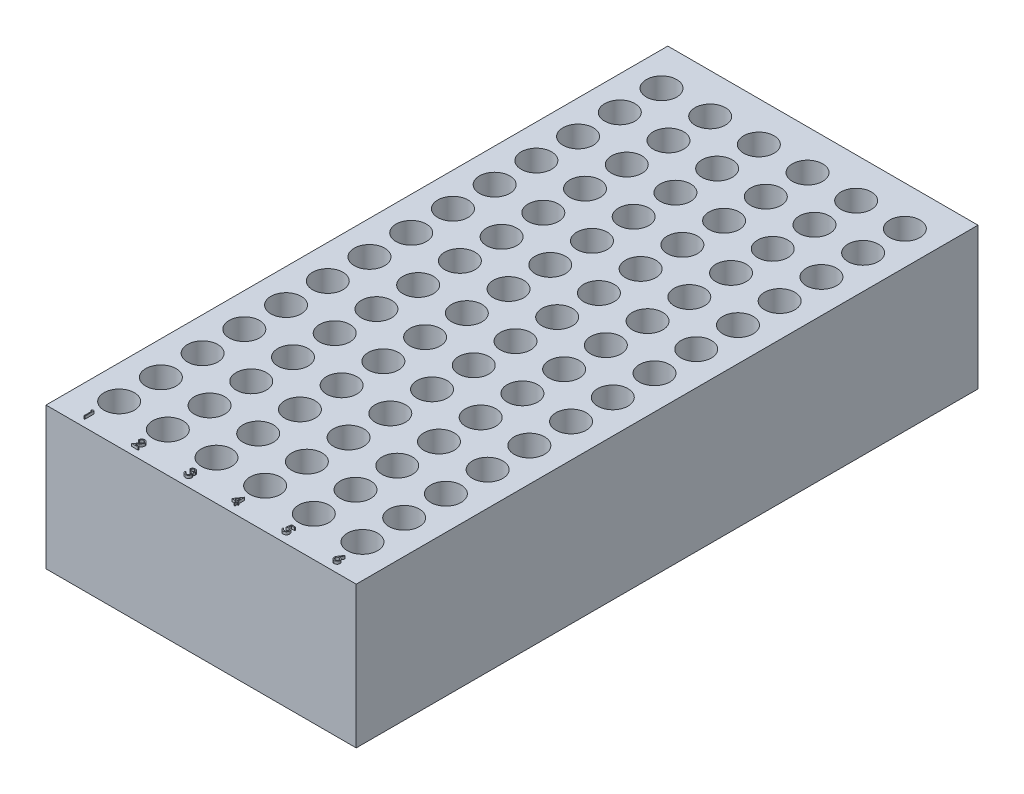
from build123d import *

# Parameters (mm, degrees)
SKETCH1_W                  = 115.25
SKETCH1_H                  = 231
SKETCH1_R                  = 5.65
BOSS_EXTRUDE1_DEPTH        = 21.7
SKETCH2_W                  = 115.25
SKETCH2_H                  = 231
BOSS_EXTRUDE2_DEPTH        = 31
SKETCH6_R                  = 4.225
CUT_EXTRUDE1_DEPTH         = 30
SHELL11_T                  = -0.5
SHELL11_THICKNESS_2_FACE_W = 230
SHELL11_THICKNESS_2_FACE_H = 52.2
SHELL11_THICKNESS_2_DEPTH  = 4.5
SHELL11_THICKNESS_3_FACE_W = 109.75
SHELL11_THICKNESS_3_FACE_H = 52.2
SHELL11_THICKNESS_3_DEPTH  = 4.5
SHELL11_THICKNESS_4_FACE_W = 225.5
SHELL11_THICKNESS_4_FACE_H = 52.2
SHELL11_THICKNESS_4_DEPTH  = 4.5
SHELL11_THICKNESS_5_FACE_W = 105.25
SHELL11_THICKNESS_5_FACE_H = 52.2
SHELL11_THICKNESS_5_DEPTH  = 4.5
SHELL11_THICKNESS_6_FACE_W = 221
SHELL11_THICKNESS_6_FACE_H = 105.25
SHELL11_THICKNESS_6_FACE_R = 6.15
SHELL11_THICKNESS_6_DEPTH  = 4.5
BOSS_EXTRUDE5_DEPTH        = 1


with BuildPart() as part:
    # Sketch1 → Boss-Extrude1 (new body)
    with BuildSketch(Plane(origin=(0, 0, 0), x_dir=(1, 0, 0), z_dir=(0, 1, 0))):
        Rectangle(SKETCH1_W, SKETCH1_H)
        with Locations((-45.196428571, 100.75)):
            Circle(SKETCH1_R, mode=Mode.SUBTRACT)
        with Locations((-27.117857143, 100.75)):
            Circle(SKETCH1_R, mode=Mode.SUBTRACT)
        with Locations((-9.039285714, 100.75)):
            Circle(SKETCH1_R, mode=Mode.SUBTRACT)
        with Locations((9.039285714, 100.75)):
            Circle(SKETCH1_R, mode=Mode.SUBTRACT)
        with Locations((27.117857143, 100.75)):
            Circle(SKETCH1_R, mode=Mode.SUBTRACT)
        with Locations((45.196428571, 100.75)):
            Circle(SKETCH1_R, mode=Mode.SUBTRACT)
        with Locations((-45.196428571, 85.25)):
            Circle(SKETCH1_R, mode=Mode.SUBTRACT)
        with Locations((-27.117857143, 85.25)):
            Circle(SKETCH1_R, mode=Mode.SUBTRACT)
        with Locations((-9.039285714, 85.25)):
            Circle(SKETCH1_R, mode=Mode.SUBTRACT)
        with Locations((9.039285714, 85.25)):
            Circle(SKETCH1_R, mode=Mode.SUBTRACT)
        with Locations((27.117857143, 85.25)):
            Circle(SKETCH1_R, mode=Mode.SUBTRACT)
        with Locations((45.196428571, 85.25)):
            Circle(SKETCH1_R, mode=Mode.SUBTRACT)
        with Locations((-45.196428571, 69.75)):
            Circle(SKETCH1_R, mode=Mode.SUBTRACT)
        with Locations((-27.117857143, 69.75)):
            Circle(SKETCH1_R, mode=Mode.SUBTRACT)
        with Locations((-9.039285714, 69.75)):
            Circle(SKETCH1_R, mode=Mode.SUBTRACT)
        with Locations((9.039285714, 69.75)):
            Circle(SKETCH1_R, mode=Mode.SUBTRACT)
        with Locations((27.117857143, 69.75)):
            Circle(SKETCH1_R, mode=Mode.SUBTRACT)
        with Locations((45.196428571, 69.75)):
            Circle(SKETCH1_R, mode=Mode.SUBTRACT)
        with Locations((-45.196428571, 54.25)):
            Circle(SKETCH1_R, mode=Mode.SUBTRACT)
        with Locations((-27.117857143, 54.25)):
            Circle(SKETCH1_R, mode=Mode.SUBTRACT)
        with Locations((-9.039285714, 54.25)):
            Circle(SKETCH1_R, mode=Mode.SUBTRACT)
        with Locations((9.039285714, 54.25)):
            Circle(SKETCH1_R, mode=Mode.SUBTRACT)
        with Locations((27.117857143, 54.25)):
            Circle(SKETCH1_R, mode=Mode.SUBTRACT)
        with Locations((45.196428571, 54.25)):
            Circle(SKETCH1_R, mode=Mode.SUBTRACT)
        with Locations((-45.196428571, 38.75)):
            Circle(SKETCH1_R, mode=Mode.SUBTRACT)
        with Locations((-27.117857143, 38.75)):
            Circle(SKETCH1_R, mode=Mode.SUBTRACT)
        with Locations((-9.039285714, 38.75)):
            Circle(SKETCH1_R, mode=Mode.SUBTRACT)
        with Locations((9.039285714, 38.75)):
            Circle(SKETCH1_R, mode=Mode.SUBTRACT)
        with Locations((27.117857143, 38.75)):
            Circle(SKETCH1_R, mode=Mode.SUBTRACT)
        with Locations((45.196428571, 38.75)):
            Circle(SKETCH1_R, mode=Mode.SUBTRACT)
        with Locations((-45.196428571, 23.25)):
            Circle(SKETCH1_R, mode=Mode.SUBTRACT)
        with Locations((-27.117857143, 23.25)):
            Circle(SKETCH1_R, mode=Mode.SUBTRACT)
        with Locations((-9.039285714, 23.25)):
            Circle(SKETCH1_R, mode=Mode.SUBTRACT)
        with Locations((9.039285714, 23.25)):
            Circle(SKETCH1_R, mode=Mode.SUBTRACT)
        with Locations((27.117857143, 23.25)):
            Circle(SKETCH1_R, mode=Mode.SUBTRACT)
        with Locations((45.196428571, 23.25)):
            Circle(SKETCH1_R, mode=Mode.SUBTRACT)
        with Locations((-45.196428571, 7.75)):
            Circle(SKETCH1_R, mode=Mode.SUBTRACT)
        with Locations((-27.117857143, 7.75)):
            Circle(SKETCH1_R, mode=Mode.SUBTRACT)
        with Locations((-9.039285714, 7.75)):
            Circle(SKETCH1_R, mode=Mode.SUBTRACT)
        with Locations((9.039285714, 7.75)):
            Circle(SKETCH1_R, mode=Mode.SUBTRACT)
        with Locations((27.117857143, 7.75)):
            Circle(SKETCH1_R, mode=Mode.SUBTRACT)
        with Locations((45.196428571, 7.75)):
            Circle(SKETCH1_R, mode=Mode.SUBTRACT)
        with Locations((-45.196428571, -7.75)):
            Circle(SKETCH1_R, mode=Mode.SUBTRACT)
        with Locations((-27.117857143, -7.75)):
            Circle(SKETCH1_R, mode=Mode.SUBTRACT)
        with Locations((-9.039285714, -7.75)):
            Circle(SKETCH1_R, mode=Mode.SUBTRACT)
        with Locations((9.039285714, -7.75)):
            Circle(SKETCH1_R, mode=Mode.SUBTRACT)
        with Locations((27.117857143, -7.75)):
            Circle(SKETCH1_R, mode=Mode.SUBTRACT)
        with Locations((45.196428571, -7.75)):
            Circle(SKETCH1_R, mode=Mode.SUBTRACT)
        with Locations((-45.196428571, -23.25)):
            Circle(SKETCH1_R, mode=Mode.SUBTRACT)
        with Locations((-27.117857143, -23.25)):
            Circle(SKETCH1_R, mode=Mode.SUBTRACT)
        with Locations((-9.039285714, -23.25)):
            Circle(SKETCH1_R, mode=Mode.SUBTRACT)
        with Locations((9.039285714, -23.25)):
            Circle(SKETCH1_R, mode=Mode.SUBTRACT)
        with Locations((27.117857143, -23.25)):
            Circle(SKETCH1_R, mode=Mode.SUBTRACT)
        with Locations((45.196428571, -23.25)):
            Circle(SKETCH1_R, mode=Mode.SUBTRACT)
        with Locations((-45.196428571, -38.75)):
            Circle(SKETCH1_R, mode=Mode.SUBTRACT)
        with Locations((-27.117857143, -38.75)):
            Circle(SKETCH1_R, mode=Mode.SUBTRACT)
        with Locations((-9.039285714, -38.75)):
            Circle(SKETCH1_R, mode=Mode.SUBTRACT)
        with Locations((9.039285714, -38.75)):
            Circle(SKETCH1_R, mode=Mode.SUBTRACT)
        with Locations((27.117857143, -38.75)):
            Circle(SKETCH1_R, mode=Mode.SUBTRACT)
        with Locations((45.196428571, -38.75)):
            Circle(SKETCH1_R, mode=Mode.SUBTRACT)
        with Locations((-45.196428571, -54.25)):
            Circle(SKETCH1_R, mode=Mode.SUBTRACT)
        with Locations((-27.117857143, -54.25)):
            Circle(SKETCH1_R, mode=Mode.SUBTRACT)
        with Locations((-9.039285714, -54.25)):
            Circle(SKETCH1_R, mode=Mode.SUBTRACT)
        with Locations((9.039285714, -54.25)):
            Circle(SKETCH1_R, mode=Mode.SUBTRACT)
        with Locations((27.117857143, -54.25)):
            Circle(SKETCH1_R, mode=Mode.SUBTRACT)
        with Locations((45.196428571, -54.25)):
            Circle(SKETCH1_R, mode=Mode.SUBTRACT)
        with Locations((-45.196428571, -69.75)):
            Circle(SKETCH1_R, mode=Mode.SUBTRACT)
        with Locations((-27.117857143, -69.75)):
            Circle(SKETCH1_R, mode=Mode.SUBTRACT)
        with Locations((-9.039285714, -69.75)):
            Circle(SKETCH1_R, mode=Mode.SUBTRACT)
        with Locations((9.039285714, -69.75)):
            Circle(SKETCH1_R, mode=Mode.SUBTRACT)
        with Locations((27.117857143, -69.75)):
            Circle(SKETCH1_R, mode=Mode.SUBTRACT)
        with Locations((45.196428571, -69.75)):
            Circle(SKETCH1_R, mode=Mode.SUBTRACT)
        with Locations((-45.196428571, -85.25)):
            Circle(SKETCH1_R, mode=Mode.SUBTRACT)
        with Locations((-27.117857143, -85.25)):
            Circle(SKETCH1_R, mode=Mode.SUBTRACT)
        with Locations((-9.039285714, -85.25)):
            Circle(SKETCH1_R, mode=Mode.SUBTRACT)
        with Locations((9.039285714, -85.25)):
            Circle(SKETCH1_R, mode=Mode.SUBTRACT)
        with Locations((27.117857143, -85.25)):
            Circle(SKETCH1_R, mode=Mode.SUBTRACT)
        with Locations((45.196428571, -85.25)):
            Circle(SKETCH1_R, mode=Mode.SUBTRACT)
        with Locations((-45.196428571, -100.75)):
            Circle(SKETCH1_R, mode=Mode.SUBTRACT)
        with Locations((-27.117857143, -100.75)):
            Circle(SKETCH1_R, mode=Mode.SUBTRACT)
        with Locations((-9.039285714, -100.75)):
            Circle(SKETCH1_R, mode=Mode.SUBTRACT)
        with Locations((9.039285714, -100.75)):
            Circle(SKETCH1_R, mode=Mode.SUBTRACT)
        with Locations((27.117857143, -100.75)):
            Circle(SKETCH1_R, mode=Mode.SUBTRACT)
        with Locations((45.196428571, -100.75)):
            Circle(SKETCH1_R, mode=Mode.SUBTRACT)
    extrude(amount=BOSS_EXTRUDE1_DEPTH)

    # Sketch2 → Boss-Extrude2 (add)
    with BuildSketch(Plane.XZ):
        Rectangle(SKETCH2_W, SKETCH2_H)
    extrude(amount=BOSS_EXTRUDE2_DEPTH)

    # Sketch6 → Cut-Extrude1 (cut)
    with BuildSketch(Plane(origin=(0, 0, 0), x_dir=(1, 0, 0), z_dir=(0, 1, 0))):
        with Locations((-45.196428571, 100.75)):
            Circle(SKETCH6_R)
        with Locations((-27.116428571, 100.75)):
            Circle(SKETCH6_R)
        with Locations((-9.036428571, 100.75)):
            Circle(SKETCH6_R)
        with Locations((9.043571429, 100.75)):
            Circle(SKETCH6_R)
        with Locations((27.123571429, 100.75)):
            Circle(SKETCH6_R)
        with Locations((45.203571429, 100.75)):
            Circle(SKETCH6_R)
        with Locations((-45.196428571, 85.25)):
            Circle(SKETCH6_R)
        with Locations((-27.116428571, 85.25)):
            Circle(SKETCH6_R)
        with Locations((-9.036428571, 85.25)):
            Circle(SKETCH6_R)
        with Locations((9.043571429, 85.25)):
            Circle(SKETCH6_R)
        with Locations((27.123571429, 85.25)):
            Circle(SKETCH6_R)
        with Locations((45.203571429, 85.25)):
            Circle(SKETCH6_R)
        with Locations((-45.196428571, 69.75)):
            Circle(SKETCH6_R)
        with Locations((-27.116428571, 69.75)):
            Circle(SKETCH6_R)
        with Locations((-9.036428571, 69.75)):
            Circle(SKETCH6_R)
        with Locations((9.043571429, 69.75)):
            Circle(SKETCH6_R)
        with Locations((27.123571429, 69.75)):
            Circle(SKETCH6_R)
        with Locations((45.203571429, 69.75)):
            Circle(SKETCH6_R)
        with Locations((-45.196428571, 54.25)):
            Circle(SKETCH6_R)
        with Locations((-27.116428571, 54.25)):
            Circle(SKETCH6_R)
        with Locations((-9.036428571, 54.25)):
            Circle(SKETCH6_R)
        with Locations((9.043571429, 54.25)):
            Circle(SKETCH6_R)
        with Locations((27.123571429, 54.25)):
            Circle(SKETCH6_R)
        with Locations((45.203571429, 54.25)):
            Circle(SKETCH6_R)
        with Locations((-45.196428571, 38.75)):
            Circle(SKETCH6_R)
        with Locations((-27.116428571, 38.75)):
            Circle(SKETCH6_R)
        with Locations((-9.036428571, 38.75)):
            Circle(SKETCH6_R)
        with Locations((9.043571429, 38.75)):
            Circle(SKETCH6_R)
        with Locations((27.123571429, 38.75)):
            Circle(SKETCH6_R)
        with Locations((45.203571429, 38.75)):
            Circle(SKETCH6_R)
        with Locations((-45.196428571, 23.25)):
            Circle(SKETCH6_R)
        with Locations((-27.116428571, 23.25)):
            Circle(SKETCH6_R)
        with Locations((-9.036428571, 23.25)):
            Circle(SKETCH6_R)
        with Locations((9.043571429, 23.25)):
            Circle(SKETCH6_R)
        with Locations((27.123571429, 23.25)):
            Circle(SKETCH6_R)
        with Locations((45.203571429, 23.25)):
            Circle(SKETCH6_R)
        with Locations((-45.196428571, 7.75)):
            Circle(SKETCH6_R)
        with Locations((-27.116428571, 7.75)):
            Circle(SKETCH6_R)
        with Locations((-9.036428571, 7.75)):
            Circle(SKETCH6_R)
        with Locations((9.043571429, 7.75)):
            Circle(SKETCH6_R)
        with Locations((27.123571429, 7.75)):
            Circle(SKETCH6_R)
        with Locations((45.203571429, 7.75)):
            Circle(SKETCH6_R)
        with Locations((-45.196428571, -7.75)):
            Circle(SKETCH6_R)
        with Locations((-27.116428571, -7.75)):
            Circle(SKETCH6_R)
        with Locations((-9.036428571, -7.75)):
            Circle(SKETCH6_R)
        with Locations((9.043571429, -7.75)):
            Circle(SKETCH6_R)
        with Locations((27.123571429, -7.75)):
            Circle(SKETCH6_R)
        with Locations((45.203571429, -7.75)):
            Circle(SKETCH6_R)
        with Locations((-45.196428571, -23.25)):
            Circle(SKETCH6_R)
        with Locations((-27.116428571, -23.25)):
            Circle(SKETCH6_R)
        with Locations((-9.036428571, -23.25)):
            Circle(SKETCH6_R)
        with Locations((9.043571429, -23.25)):
            Circle(SKETCH6_R)
        with Locations((27.123571429, -23.25)):
            Circle(SKETCH6_R)
        with Locations((45.203571429, -23.25)):
            Circle(SKETCH6_R)
        with Locations((-45.196428571, -38.75)):
            Circle(SKETCH6_R)
        with Locations((-27.116428571, -38.75)):
            Circle(SKETCH6_R)
        with Locations((-9.036428571, -38.75)):
            Circle(SKETCH6_R)
        with Locations((9.043571429, -38.75)):
            Circle(SKETCH6_R)
        with Locations((27.123571429, -38.75)):
            Circle(SKETCH6_R)
        with Locations((45.203571429, -38.75)):
            Circle(SKETCH6_R)
        with Locations((-45.196428571, -54.25)):
            Circle(SKETCH6_R)
        with Locations((-27.116428571, -54.25)):
            Circle(SKETCH6_R)
        with Locations((-9.036428571, -54.25)):
            Circle(SKETCH6_R)
        with Locations((9.043571429, -54.25)):
            Circle(SKETCH6_R)
        with Locations((27.123571429, -54.25)):
            Circle(SKETCH6_R)
        with Locations((45.203571429, -54.25)):
            Circle(SKETCH6_R)
        with Locations((-45.196428571, -69.75)):
            Circle(SKETCH6_R)
        with Locations((-27.116428571, -69.75)):
            Circle(SKETCH6_R)
        with Locations((-9.036428571, -69.75)):
            Circle(SKETCH6_R)
        with Locations((9.043571429, -69.75)):
            Circle(SKETCH6_R)
        with Locations((27.123571429, -69.75)):
            Circle(SKETCH6_R)
        with Locations((45.203571429, -69.75)):
            Circle(SKETCH6_R)
        with Locations((-45.196428571, -85.25)):
            Circle(SKETCH6_R)
        with Locations((-27.116428571, -85.25)):
            Circle(SKETCH6_R)
        with Locations((-9.036428571, -85.25)):
            Circle(SKETCH6_R)
        with Locations((9.043571429, -85.25)):
            Circle(SKETCH6_R)
        with Locations((27.123571429, -85.25)):
            Circle(SKETCH6_R)
        with Locations((45.203571429, -85.25)):
            Circle(SKETCH6_R)
        with Locations((-45.196428571, -100.75)):
            Circle(SKETCH6_R)
        with Locations((-27.116428571, -100.75)):
            Circle(SKETCH6_R)
        with Locations((-9.036428571, -100.75)):
            Circle(SKETCH6_R)
        with Locations((9.043571429, -100.75)):
            Circle(SKETCH6_R)
        with Locations((27.123571429, -100.75)):
            Circle(SKETCH6_R)
        with Locations((45.203571429, -100.75)):
            Circle(SKETCH6_R)
    extrude(amount=-CUT_EXTRUDE1_DEPTH, mode=Mode.SUBTRACT)

    # Shell11
    shell11_openings = [part.faces().sort_by_distance(p)[0] for p in [
        (0, -31, 0),
    ]]
    offset(amount=SHELL11_T, openings=shell11_openings, kind=Kind.INTERSECTION)

    # Shell11 thickness 2 face (on inner face of the shell) → Shell11 thickness 2 (add)
    with BuildSketch(Plane(origin=(57.125, -4.9, 0), x_dir=(0, 0, 1), z_dir=(1, 0, 0))):
        Rectangle(SHELL11_THICKNESS_2_FACE_W, SHELL11_THICKNESS_2_FACE_H)
    extrude(amount=-SHELL11_THICKNESS_2_DEPTH)

    # Shell11 thickness 3 face (on inner face of the shell) → Shell11 thickness 3 (add)
    with BuildSketch(Plane(origin=(-2.25, -4.9, 115), x_dir=(1, 0, 0), z_dir=(0, 0, 1))):
        Rectangle(SHELL11_THICKNESS_3_FACE_W, SHELL11_THICKNESS_3_FACE_H)
    extrude(amount=-SHELL11_THICKNESS_3_DEPTH)

    # Shell11 thickness 4 face (on inner face of the shell) → Shell11 thickness 4 (add)
    with BuildSketch(Plane(origin=(-57.125, -4.9, -2.25), x_dir=(0, 0, -1), z_dir=(-1, 0, 0))):
        Rectangle(SHELL11_THICKNESS_4_FACE_W, SHELL11_THICKNESS_4_FACE_H)
    extrude(amount=-SHELL11_THICKNESS_4_DEPTH)

    # Shell11 thickness 5 face (on inner face of the shell) → Shell11 thickness 5 (add)
    with BuildSketch(Plane(origin=(0, -4.9, -115), x_dir=(-1, 0, 0), z_dir=(0, 0, -1))):
        Rectangle(SHELL11_THICKNESS_5_FACE_W, SHELL11_THICKNESS_5_FACE_H)
    extrude(amount=-SHELL11_THICKNESS_5_DEPTH)

    # Shell11 thickness 6 face (on inner face of the shell) → Shell11 thickness 6 (add)
    with BuildSketch(Plane.ZX.offset(21.2)):
        Rectangle(SHELL11_THICKNESS_6_FACE_W, SHELL11_THICKNESS_6_FACE_H)
        with Locations((100.75, 45.196428571)):
            Circle(SHELL11_THICKNESS_6_FACE_R, mode=Mode.SUBTRACT)
        with Locations((85.25, 45.196428571)):
            Circle(SHELL11_THICKNESS_6_FACE_R, mode=Mode.SUBTRACT)
        with Locations((100.75, 27.117857143)):
            Circle(SHELL11_THICKNESS_6_FACE_R, mode=Mode.SUBTRACT)
        with Locations((85.25, 27.117857143)):
            Circle(SHELL11_THICKNESS_6_FACE_R, mode=Mode.SUBTRACT)
        with Locations((69.75, 45.196428571)):
            Circle(SHELL11_THICKNESS_6_FACE_R, mode=Mode.SUBTRACT)
        with Locations((54.25, 45.196428571)):
            Circle(SHELL11_THICKNESS_6_FACE_R, mode=Mode.SUBTRACT)
        with Locations((69.75, 27.117857143)):
            Circle(SHELL11_THICKNESS_6_FACE_R, mode=Mode.SUBTRACT)
        with Locations((54.25, 27.117857143)):
            Circle(SHELL11_THICKNESS_6_FACE_R, mode=Mode.SUBTRACT)
        with Locations((100.75, 9.039285714)):
            Circle(SHELL11_THICKNESS_6_FACE_R, mode=Mode.SUBTRACT)
        with Locations((85.25, 9.039285714)):
            Circle(SHELL11_THICKNESS_6_FACE_R, mode=Mode.SUBTRACT)
        with Locations((69.75, 9.039285714)):
            Circle(SHELL11_THICKNESS_6_FACE_R, mode=Mode.SUBTRACT)
        with Locations((54.25, 9.039285714)):
            Circle(SHELL11_THICKNESS_6_FACE_R, mode=Mode.SUBTRACT)
        with Locations((38.75, 45.196428571)):
            Circle(SHELL11_THICKNESS_6_FACE_R, mode=Mode.SUBTRACT)
        with Locations((38.75, 27.117857143)):
            Circle(SHELL11_THICKNESS_6_FACE_R, mode=Mode.SUBTRACT)
        with Locations((23.25, 45.196428571)):
            Circle(SHELL11_THICKNESS_6_FACE_R, mode=Mode.SUBTRACT)
        with Locations((7.75, 45.196428571)):
            Circle(SHELL11_THICKNESS_6_FACE_R, mode=Mode.SUBTRACT)
        with Locations((23.25, 27.117857143)):
            Circle(SHELL11_THICKNESS_6_FACE_R, mode=Mode.SUBTRACT)
        with Locations((7.75, 27.117857143)):
            Circle(SHELL11_THICKNESS_6_FACE_R, mode=Mode.SUBTRACT)
        with Locations((38.75, 9.039285714)):
            Circle(SHELL11_THICKNESS_6_FACE_R, mode=Mode.SUBTRACT)
        with Locations((23.25, 9.039285714)):
            Circle(SHELL11_THICKNESS_6_FACE_R, mode=Mode.SUBTRACT)
        with Locations((7.75, 9.039285714)):
            Circle(SHELL11_THICKNESS_6_FACE_R, mode=Mode.SUBTRACT)
        with Locations((100.75, -9.039285714)):
            Circle(SHELL11_THICKNESS_6_FACE_R, mode=Mode.SUBTRACT)
        with Locations((85.25, -9.039285714)):
            Circle(SHELL11_THICKNESS_6_FACE_R, mode=Mode.SUBTRACT)
        with Locations((69.75, -9.039285714)):
            Circle(SHELL11_THICKNESS_6_FACE_R, mode=Mode.SUBTRACT)
        with Locations((54.25, -9.039285714)):
            Circle(SHELL11_THICKNESS_6_FACE_R, mode=Mode.SUBTRACT)
        with Locations((100.75, -27.117857143)):
            Circle(SHELL11_THICKNESS_6_FACE_R, mode=Mode.SUBTRACT)
        with Locations((85.25, -27.117857143)):
            Circle(SHELL11_THICKNESS_6_FACE_R, mode=Mode.SUBTRACT)
        with Locations((100.75, -45.196428571)):
            Circle(SHELL11_THICKNESS_6_FACE_R, mode=Mode.SUBTRACT)
        with Locations((85.25, -45.196428571)):
            Circle(SHELL11_THICKNESS_6_FACE_R, mode=Mode.SUBTRACT)
        with Locations((69.75, -27.117857143)):
            Circle(SHELL11_THICKNESS_6_FACE_R, mode=Mode.SUBTRACT)
        with Locations((54.25, -27.117857143)):
            Circle(SHELL11_THICKNESS_6_FACE_R, mode=Mode.SUBTRACT)
        with Locations((69.75, -45.196428571)):
            Circle(SHELL11_THICKNESS_6_FACE_R, mode=Mode.SUBTRACT)
        with Locations((54.25, -45.196428571)):
            Circle(SHELL11_THICKNESS_6_FACE_R, mode=Mode.SUBTRACT)
        with Locations((38.75, -9.039285714)):
            Circle(SHELL11_THICKNESS_6_FACE_R, mode=Mode.SUBTRACT)
        with Locations((23.25, -9.039285714)):
            Circle(SHELL11_THICKNESS_6_FACE_R, mode=Mode.SUBTRACT)
        with Locations((7.75, -9.039285714)):
            Circle(SHELL11_THICKNESS_6_FACE_R, mode=Mode.SUBTRACT)
        with Locations((38.75, -27.117857143)):
            Circle(SHELL11_THICKNESS_6_FACE_R, mode=Mode.SUBTRACT)
        with Locations((38.75, -45.196428571)):
            Circle(SHELL11_THICKNESS_6_FACE_R, mode=Mode.SUBTRACT)
        with Locations((23.25, -27.117857143)):
            Circle(SHELL11_THICKNESS_6_FACE_R, mode=Mode.SUBTRACT)
        with Locations((7.75, -27.117857143)):
            Circle(SHELL11_THICKNESS_6_FACE_R, mode=Mode.SUBTRACT)
        with Locations((23.25, -45.196428571)):
            Circle(SHELL11_THICKNESS_6_FACE_R, mode=Mode.SUBTRACT)
        with Locations((7.75, -45.196428571)):
            Circle(SHELL11_THICKNESS_6_FACE_R, mode=Mode.SUBTRACT)
        with Locations((-7.75, 45.196428571)):
            Circle(SHELL11_THICKNESS_6_FACE_R, mode=Mode.SUBTRACT)
        with Locations((-23.25, 45.196428571)):
            Circle(SHELL11_THICKNESS_6_FACE_R, mode=Mode.SUBTRACT)
        with Locations((-7.75, 27.117857143)):
            Circle(SHELL11_THICKNESS_6_FACE_R, mode=Mode.SUBTRACT)
        with Locations((-23.25, 27.117857143)):
            Circle(SHELL11_THICKNESS_6_FACE_R, mode=Mode.SUBTRACT)
        with Locations((-38.75, 45.196428571)):
            Circle(SHELL11_THICKNESS_6_FACE_R, mode=Mode.SUBTRACT)
        with Locations((-38.75, 27.117857143)):
            Circle(SHELL11_THICKNESS_6_FACE_R, mode=Mode.SUBTRACT)
        with Locations((-7.75, 9.039285714)):
            Circle(SHELL11_THICKNESS_6_FACE_R, mode=Mode.SUBTRACT)
        with Locations((-23.25, 9.039285714)):
            Circle(SHELL11_THICKNESS_6_FACE_R, mode=Mode.SUBTRACT)
        with Locations((-38.75, 9.039285714)):
            Circle(SHELL11_THICKNESS_6_FACE_R, mode=Mode.SUBTRACT)
        with Locations((-54.25, 45.196428571)):
            Circle(SHELL11_THICKNESS_6_FACE_R, mode=Mode.SUBTRACT)
        with Locations((-69.75, 45.196428571)):
            Circle(SHELL11_THICKNESS_6_FACE_R, mode=Mode.SUBTRACT)
        with Locations((-54.25, 27.117857143)):
            Circle(SHELL11_THICKNESS_6_FACE_R, mode=Mode.SUBTRACT)
        with Locations((-69.75, 27.117857143)):
            Circle(SHELL11_THICKNESS_6_FACE_R, mode=Mode.SUBTRACT)
        with Locations((-85.25, 45.196428571)):
            Circle(SHELL11_THICKNESS_6_FACE_R, mode=Mode.SUBTRACT)
        with Locations((-100.75, 45.196428571)):
            Circle(SHELL11_THICKNESS_6_FACE_R, mode=Mode.SUBTRACT)
        with Locations((-85.25, 27.117857143)):
            Circle(SHELL11_THICKNESS_6_FACE_R, mode=Mode.SUBTRACT)
        with Locations((-100.75, 27.117857143)):
            Circle(SHELL11_THICKNESS_6_FACE_R, mode=Mode.SUBTRACT)
        with Locations((-54.25, 9.039285714)):
            Circle(SHELL11_THICKNESS_6_FACE_R, mode=Mode.SUBTRACT)
        with Locations((-69.75, 9.039285714)):
            Circle(SHELL11_THICKNESS_6_FACE_R, mode=Mode.SUBTRACT)
        with Locations((-85.25, 9.039285714)):
            Circle(SHELL11_THICKNESS_6_FACE_R, mode=Mode.SUBTRACT)
        with Locations((-100.75, 9.039285714)):
            Circle(SHELL11_THICKNESS_6_FACE_R, mode=Mode.SUBTRACT)
        with Locations((-7.75, -9.039285714)):
            Circle(SHELL11_THICKNESS_6_FACE_R, mode=Mode.SUBTRACT)
        with Locations((-23.25, -9.039285714)):
            Circle(SHELL11_THICKNESS_6_FACE_R, mode=Mode.SUBTRACT)
        with Locations((-38.75, -9.039285714)):
            Circle(SHELL11_THICKNESS_6_FACE_R, mode=Mode.SUBTRACT)
        with Locations((-7.75, -27.117857143)):
            Circle(SHELL11_THICKNESS_6_FACE_R, mode=Mode.SUBTRACT)
        with Locations((-23.25, -27.117857143)):
            Circle(SHELL11_THICKNESS_6_FACE_R, mode=Mode.SUBTRACT)
        with Locations((-7.75, -45.196428571)):
            Circle(SHELL11_THICKNESS_6_FACE_R, mode=Mode.SUBTRACT)
        with Locations((-23.25, -45.196428571)):
            Circle(SHELL11_THICKNESS_6_FACE_R, mode=Mode.SUBTRACT)
        with Locations((-38.75, -27.117857143)):
            Circle(SHELL11_THICKNESS_6_FACE_R, mode=Mode.SUBTRACT)
        with Locations((-38.75, -45.196428571)):
            Circle(SHELL11_THICKNESS_6_FACE_R, mode=Mode.SUBTRACT)
        with Locations((-54.25, -9.039285714)):
            Circle(SHELL11_THICKNESS_6_FACE_R, mode=Mode.SUBTRACT)
        with Locations((-69.75, -9.039285714)):
            Circle(SHELL11_THICKNESS_6_FACE_R, mode=Mode.SUBTRACT)
        with Locations((-85.25, -9.039285714)):
            Circle(SHELL11_THICKNESS_6_FACE_R, mode=Mode.SUBTRACT)
        with Locations((-100.75, -9.039285714)):
            Circle(SHELL11_THICKNESS_6_FACE_R, mode=Mode.SUBTRACT)
        with Locations((-54.25, -27.117857143)):
            Circle(SHELL11_THICKNESS_6_FACE_R, mode=Mode.SUBTRACT)
        with Locations((-69.75, -27.117857143)):
            Circle(SHELL11_THICKNESS_6_FACE_R, mode=Mode.SUBTRACT)
        with Locations((-54.25, -45.196428571)):
            Circle(SHELL11_THICKNESS_6_FACE_R, mode=Mode.SUBTRACT)
        with Locations((-69.75, -45.196428571)):
            Circle(SHELL11_THICKNESS_6_FACE_R, mode=Mode.SUBTRACT)
        with Locations((-85.25, -27.117857143)):
            Circle(SHELL11_THICKNESS_6_FACE_R, mode=Mode.SUBTRACT)
        with Locations((-100.75, -27.117857143)):
            Circle(SHELL11_THICKNESS_6_FACE_R, mode=Mode.SUBTRACT)
        with Locations((-85.25, -45.196428571)):
            Circle(SHELL11_THICKNESS_6_FACE_R, mode=Mode.SUBTRACT)
        with Locations((-100.75, -45.196428571)):
            Circle(SHELL11_THICKNESS_6_FACE_R, mode=Mode.SUBTRACT)
    extrude(amount=-SHELL11_THICKNESS_6_DEPTH)

    # Sketch5 → Boss-Extrude5 (add)
    # profile 1 of 6: a face of its own
    with BuildSketch(Plane(origin=(0, 21.7, 0), x_dir=(1, 0, 0), z_dir=(0, 1, 0))):
        Polygon((-46.47985045, -109.391028324), (-45.832715033, -109.391028324), (-45.832715033, -112.891028324), (-46.146817598, -112.891028324), (-46.146817598, -109.750002683), (-46.685279136, -109.750002683), align=None)
    # profile 2 of 6: a face of its own
    with BuildSketch(Plane(origin=(0, 21.7, 0), x_dir=(1, 0, 0), z_dir=(0, 1, 0))):
        with BuildLine():
            Line((-27.92886888, -110.467951401), (-28.242971444, -110.467951401))
            add(Edge.make_bspline(
                [(-28.242971444, -110.467951401), (-28.240924291, -110.426280513), (-28.236903737, -110.344439999), (-28.218075447, -110.225116092), (-28.19113457, -110.111061293), (-28.153043116, -110.003191379), (-28.105736838, -109.900552572), (-28.049006811, -109.803552557), (-27.981812961, -109.712561368), (-27.905606226, -109.628422525), (-27.822837587, -109.551234954), (-27.733531648, -109.484579711), (-27.639686621, -109.42826204), (-27.541587222, -109.381180798), (-27.438126658, -109.345840952), (-27.3302438, -109.319619312), (-27.217464664, -109.303842966), (-27.140624642, -109.302147181), (-27.101545162, -109.301284734)],
                knots=[0, 0, 0, 0, 1.10065271, 2.161652631, 3.183658789, 4.190468796, 5.17591951, 6.163126047, 7.15150782, 8.156236427, 9.156009102, 10.134482811, 11.092018607, 12.041330605, 13.001268258, 13.972401359, 14.968799086, 16, 16, 16, 16], degree=3))
            add(Edge.make_bspline(
                [(-27.101545162, -109.301284734), (-27.063167088, -109.302183191), (-26.987755543, -109.303948626), (-26.877693528, -109.319109655), (-26.772916234, -109.342855246), (-26.673628467, -109.376170663), (-26.580622403, -109.42095509), (-26.493199358, -109.474752629), (-26.410318548, -109.53697246), (-26.335711764, -109.610226274), (-26.267203685, -109.688428658), (-26.20810143, -109.771916562), (-26.157488266, -109.858145847), (-26.115300586, -109.947774049), (-26.084244447, -110.041645077), (-26.060666239, -110.13839228), (-26.047338826, -110.239017091), (-26.045293402, -110.307123647), (-26.044253495, -110.341749478)],
                knots=[0, 0, 0, 0, 1.111607364, 2.184268762, 3.212621178, 4.221274766, 5.211760367, 6.196651075, 7.1921475, 8.207485113, 9.220403448, 10.201281604, 11.166441695, 12.114753415, 13.065576456, 14.026450734, 14.996634279, 16, 16, 16, 16], degree=3))
            add(Edge.make_bspline(
                [(-26.044253495, -110.341749478), (-26.045946758, -110.390497312), (-26.049303569, -110.487137526), (-26.078017946, -110.629152389), (-26.122864457, -110.766745808), (-26.176861814, -110.87748311), (-26.231334258, -110.966716604), (-26.280421765, -111.040185309), (-26.337886576, -111.119290777), (-26.404565074, -111.203768114), (-26.479077946, -111.29427902), (-26.56210011, -111.390768815), (-26.654223592, -111.492240585), (-26.718882093, -111.561546186), (-26.752386508, -111.597458612)],
                knots=[0, 0, 0, 0, 1.184426356, 2.348067706, 3.509069118, 4.696110526, 5.333549288, 6.050745305, 6.844228056, 7.710549037, 8.667450064, 9.695053472, 10.805634456, 12, 12, 12, 12], degree=3))
            Line((-26.752386508, -111.597458612), (-27.62808763, -112.532053965))
            Line((-27.62808763, -112.532053965), (-25.9993817, -112.532053965))
            Line((-25.9993817, -112.532053965), (-25.9993817, -112.891028324))
            Line((-25.9993817, -112.891028324), (-28.377586828, -112.891028324))
            Line((-28.377586828, -112.891028324), (-27.020215033, -111.442510696))
            add(Edge.make_bspline(
                [(-27.020215033, -111.442510696), (-26.987167147, -111.408012389), (-26.92368892, -111.341748203), (-26.833906343, -111.245005242), (-26.753267354, -111.155255702), (-26.681249962, -111.072669153), (-26.619416456, -110.996037586), (-26.564544224, -110.927842882), (-26.520578633, -110.865088432), (-26.472863238, -110.792347818), (-26.426649256, -110.703535501), (-26.3869369, -110.595001811), (-26.362722052, -110.483274559), (-26.359817216, -110.407772522), (-26.358356059, -110.36979435)],
                knots=[0, 0, 0, 0, 1.329631726, 2.553950428, 3.673215718, 4.687767853, 5.603093632, 6.413772471, 7.123043292, 7.734684054, 8.834405432, 9.900288307, 10.943827018, 12, 12, 12, 12], degree=3))
            add(Edge.make_bspline(
                [(-26.358356059, -110.36979435), (-26.358991801, -110.345912951), (-26.360244727, -110.298847301), (-26.371302425, -110.229841542), (-26.388012931, -110.163276728), (-26.411958189, -110.098948109), (-26.443564929, -110.037502457), (-26.482038309, -109.978864977), (-26.526428372, -109.922176011), (-26.577779642, -109.869022713), (-26.634191162, -109.820341508), (-26.693785411, -109.777217422), (-26.756835515, -109.741178312), (-26.823075638, -109.711634814), (-26.892321107, -109.688459433), (-26.964705852, -109.672400854), (-27.040029868, -109.66231837), (-27.091463364, -109.660954198), (-27.117670963, -109.660259093)],
                knots=[0, 0, 0, 0, 0.991446411, 1.95395049, 2.89581595, 3.838931463, 4.798493298, 5.75982156, 6.748411868, 7.785213223, 8.824556874, 9.840280684, 10.836137867, 11.835679398, 12.848801643, 13.863922112, 14.911575587, 16, 16, 16, 16], degree=3))
            add(Edge.make_bspline(
                [(-27.117670963, -109.660259093), (-27.145041796, -109.660974125), (-27.198793592, -109.662378331), (-27.277712625, -109.672200995), (-27.352998402, -109.689146835), (-27.424840305, -109.71232351), (-27.493359891, -109.741782058), (-27.558223935, -109.778473803), (-27.619286824, -109.822257296), (-27.676663348, -109.871897853), (-27.729527327, -109.927165454), (-27.775974203, -109.988775417), (-27.816558217, -110.055602832), (-27.85196745, -110.127467383), (-27.88072314, -110.205021163), (-27.902696291, -110.287988868), (-27.920083138, -110.376010249), (-27.925891658, -110.436795334), (-27.92886888, -110.467951401)],
                knots=[0, 0, 0, 0, 1.031018746, 2.02475058, 2.990194455, 3.934040569, 4.864654155, 5.795059489, 6.735614925, 7.690564532, 8.649604399, 9.611025574, 10.590972636, 11.591080095, 12.624614302, 13.701020113, 14.821632451, 16, 16, 16, 16], degree=3))
        make_face()
    # profile 3 of 6: a face of its own
    with BuildSketch(Plane(origin=(0, 21.7, 0), x_dir=(1, 0, 0), z_dir=(0, 1, 0))):
        with BuildLine():
            Line((-9.082715033, -110.198720632), (-9.396817598, -110.198720632))
            add(Edge.make_bspline(
                [(-9.396817598, -110.198720632), (-9.388308047, -110.163488148), (-9.371672571, -110.094611523), (-9.336974998, -109.996204262), (-9.299175743, -109.903080741), (-9.253786638, -109.816984667), (-9.204277884, -109.736185765), (-9.147555162, -109.66251664), (-9.08623544, -109.594103675), (-9.01841049, -109.533390437), (-8.947281829, -109.478412708), (-8.871847209, -109.431537651), (-8.793624315, -109.391213498), (-8.712071182, -109.357993266), (-8.626945011, -109.332967742), (-8.539015387, -109.314810937), (-8.448051887, -109.303019822), (-8.386304297, -109.301869059), (-8.35495061, -109.301284734)],
                knots=[0, 0, 0, 0, 1.162005537, 2.271625781, 3.343758855, 4.383309926, 5.390229558, 6.379919256, 7.361854164, 8.333198761, 9.295911338, 10.242430842, 11.177959212, 12.116337295, 13.062827104, 14.020064771, 14.994644689, 16, 16, 16, 16], degree=3))
            add(Edge.make_bspline(
                [(-8.35495061, -109.301284734), (-8.309267868, -109.302663964), (-8.218898857, -109.30539234), (-8.08613581, -109.330306776), (-7.958108991, -109.369731909), (-7.836219743, -109.424205636), (-7.723001311, -109.491392949), (-7.622265124, -109.571357686), (-7.535376613, -109.662556987), (-7.462482236, -109.763289552), (-7.405407237, -109.870945061), (-7.363320863, -109.981745218), (-7.337699182, -110.09542719), (-7.334378625, -110.172184469), (-7.332715033, -110.210639702)],
                knots=[0, 0, 0, 0, 1.083050992, 2.142477498, 3.193116406, 4.255571735, 5.30263384, 6.308962982, 7.297363603, 8.282367274, 9.249857812, 10.179914175, 11.08814088, 12, 12, 12, 12], degree=3))
            add(Edge.make_bspline(
                [(-7.332715033, -110.210639702), (-7.333878624, -110.247646497), (-7.336155592, -110.320063051), (-7.355489297, -110.425784548), (-7.38802556, -110.525426149), (-7.433095323, -110.619407311), (-7.491436873, -110.707132151), (-7.56210957, -110.788798042), (-7.645612232, -110.8647672), (-7.70889117, -110.908286673), (-7.74146904, -110.930691786)],
                knots=[0, 0, 0, 0, 1.024540389, 2.004866551, 2.965041327, 3.920577974, 4.882998113, 5.874504559, 6.905732034, 8, 8, 8, 8], degree=3))
            add(Edge.make_bspline(
                [(-7.74146904, -110.930691786), (-7.704237285, -110.948669957), (-7.630470411, -110.984289915), (-7.529919881, -111.054145672), (-7.438642006, -111.13480202), (-7.387738287, -111.197744672), (-7.362162149, -111.22936967)],
                knots=[0, 0, 0, 0, 1.015518401, 2.012035669, 3.001164323, 4, 4, 4, 4], degree=3))
            add(Edge.make_bspline(
                [(-7.362162149, -111.22936967), (-7.345320806, -111.252427422), (-7.31191391, -111.298165338), (-7.270678377, -111.371701764), (-7.233269262, -111.446053253), (-7.204119043, -111.52321266), (-7.181545176, -111.602285673), (-7.165409144, -111.683408069), (-7.155385003, -111.766646092), (-7.153949451, -111.822958572), (-7.153227854, -111.851264702)],
                knots=[0, 0, 0, 0, 1.025084078, 2.033381695, 3.024893161, 4.013698104, 4.991890475, 5.976764909, 6.982997093, 8, 8, 8, 8], degree=3))
            add(Edge.make_bspline(
                [(-7.153227854, -111.851264702), (-7.155022367, -111.900274423), (-7.15860295, -111.998063225), (-7.190607024, -112.142537947), (-7.240220265, -112.283763449), (-7.3106772, -112.418838288), (-7.396544709, -112.545218669), (-7.498702033, -112.658294978), (-7.615988442, -112.755493583), (-7.746794091, -112.836703811), (-7.888511219, -112.901621733), (-8.040086811, -112.946679176), (-8.199336865, -112.976025176), (-8.308544163, -112.979172044), (-8.364065194, -112.980771914)],
                knots=[0, 0, 0, 0, 0.955779014, 1.907060117, 2.875433937, 3.871313158, 4.872415639, 5.851225146, 6.836215519, 7.83643374, 8.849228613, 9.86973379, 10.916971861, 12, 12, 12, 12], degree=3))
            add(Edge.make_bspline(
                [(-8.364065194, -112.980771914), (-8.401484494, -112.9799037), (-8.475113199, -112.978195346), (-8.583356697, -112.966516745), (-8.686678397, -112.94518674), (-8.785217995, -112.916483434), (-8.879063031, -112.880091692), (-8.967927136, -112.834772994), (-9.05235703, -112.781461492), (-9.131555981, -112.719527905), (-9.205514549, -112.650246565), (-9.272267273, -112.572387555), (-9.332927066, -112.487390151), (-9.385869704, -112.394267095), (-9.433506657, -112.294221837), (-9.472687614, -112.185973339), (-9.507173182, -112.070489317), (-9.523206647, -111.990011577), (-9.531432982, -111.948720632)],
                knots=[0, 0, 0, 0, 1.048658725, 2.063410685, 3.046034179, 4.001477787, 4.936774919, 5.862367409, 6.792675028, 7.730719943, 8.675894397, 9.627829632, 10.600096036, 11.597688215, 12.626045268, 13.701542398, 14.82072376, 16, 16, 16, 16], degree=3))
            Line((-9.531432982, -111.948720632), (-9.217330418, -111.948720632))
            add(Edge.make_bspline(
                [(-9.217330418, -111.948720632), (-9.209147127, -111.975669645), (-9.193229914, -112.028087817), (-9.166135616, -112.103528122), (-9.135267344, -112.172686175), (-9.102152785, -112.236069297), (-9.067374339, -112.2943017), (-9.028459414, -112.345843569), (-8.988290269, -112.392958771), (-8.958010916, -112.419503383), (-8.943191796, -112.43249467)],
                knots=[0, 0, 0, 0, 1.198163088, 2.33053128, 3.407730985, 4.417276592, 5.372219308, 6.28897303, 7.162600585, 8, 8, 8, 8], degree=3))
            add(Edge.make_bspline(
                [(-8.943191796, -112.43249467), (-8.92359522, -112.447603004), (-8.884462557, -112.477773036), (-8.820694326, -112.516274664), (-8.75362944, -112.54963569), (-8.681814765, -112.575119385), (-8.606799995, -112.596697046), (-8.52737263, -112.610817565), (-8.444233413, -112.620505737), (-8.387465649, -112.621360668), (-8.358456219, -112.621797555)],
                knots=[0, 0, 0, 0, 0.946170439, 1.889420265, 2.845303464, 3.807233317, 4.801018734, 5.828864929, 6.890507805, 8, 8, 8, 8], degree=3))
            add(Edge.make_bspline(
                [(-8.358456219, -112.621797555), (-8.325702717, -112.62118165), (-8.26165607, -112.6199773), (-8.16820121, -112.608901593), (-8.079293763, -112.59277118), (-7.995920837, -112.567858197), (-7.91699033, -112.537077345), (-7.84360868, -112.49842894), (-7.774812574, -112.453084218), (-7.711483169, -112.40154506), (-7.654537661, -112.345123565), (-7.604398148, -112.286110493), (-7.561773486, -112.224754664), (-7.527389908, -112.160716543), (-7.500239358, -112.094261314), (-7.481756157, -112.025202485), (-7.468904642, -111.954105219), (-7.46785803, -111.90577625), (-7.467330418, -111.881412939)],
                knots=[0, 0, 0, 0, 1.217147791, 2.380027433, 3.494444702, 4.572153297, 5.609568379, 6.639424714, 7.649109417, 8.668170816, 9.669597737, 10.625200337, 11.543417969, 12.441394052, 13.322311151, 14.205496177, 15.095365482, 16, 16, 16, 16], degree=3))
            add(Edge.make_bspline(
                [(-7.467330418, -111.881412939), (-7.46886072, -111.8488016), (-7.471913708, -111.783741192), (-7.495222288, -111.688023618), (-7.533561152, -111.595800206), (-7.587233663, -111.508644415), (-7.652569392, -111.427868514), (-7.728934299, -111.355797031), (-7.816962527, -111.29632694), (-7.897982396, -111.255238284), (-7.969747552, -111.227201209), (-8.031162937, -111.208526244), (-8.09991954, -111.192712589), (-8.175185889, -111.178000317), (-8.257529106, -111.165478969), (-8.346859544, -111.155037153), (-8.443195305, -111.146682112), (-8.509886471, -111.142951017), (-8.544253495, -111.141028324)],
                knots=[0, 0, 0, 0, 1.07054697, 2.135767047, 3.216561865, 4.33974944, 5.486079747, 6.621378074, 7.775625952, 8.963672916, 9.598146892, 10.304877434, 11.070270905, 11.915000392, 12.823868403, 13.805723172, 14.86925407, 16, 16, 16, 16], degree=3))
            Line((-8.544253495, -111.141028324), (-8.544253495, -110.782053965))
            add(Edge.make_bspline(
                [(-8.544253495, -110.782053965), (-8.500952329, -110.781319161), (-8.416135983, -110.779879861), (-8.292241678, -110.762471851), (-8.173768366, -110.738391223), (-8.063341624, -110.701506031), (-7.96269291, -110.658665734), (-7.875373308, -110.608813524), (-7.802606161, -110.553398775), (-7.74474509, -110.491566166), (-7.701215861, -110.425251118), (-7.669389064, -110.35613446), (-7.650588737, -110.2836104), (-7.64807907, -110.234115732), (-7.646817598, -110.209237459)],
                knots=[0, 0, 0, 0, 1.321986639, 2.589447074, 3.816329219, 5.01088745, 6.139805852, 7.153945165, 8.075214402, 8.924034688, 9.728124013, 10.488707548, 11.240355623, 12, 12, 12, 12], degree=3))
            add(Edge.make_bspline(
                [(-7.646817598, -110.209237459), (-7.647232009, -110.190959713), (-7.648056459, -110.154597006), (-7.658453737, -110.101471938), (-7.674077778, -110.049970992), (-7.695557508, -110.000313181), (-7.724307706, -109.952842908), (-7.758713693, -109.907155459), (-7.799681793, -109.86351168), (-7.84662724, -109.82283136), (-7.897039045, -109.784062123), (-7.95228882, -109.751148486), (-8.010710695, -109.723003424), (-8.07236935, -109.699793922), (-8.13746488, -109.682334634), (-8.205691438, -109.669798792), (-8.277179121, -109.661961137), (-8.325950853, -109.660832722), (-8.35074388, -109.660259093)],
                knots=[0, 0, 0, 0, 0.884392785, 1.759457502, 2.611959086, 3.489218968, 4.37281399, 5.2945488, 6.255912374, 7.266815255, 8.301784654, 9.332968512, 10.37626691, 11.440494194, 12.520033166, 13.637162961, 14.798855837, 16, 16, 16, 16], degree=3))
            add(Edge.make_bspline(
                [(-8.35074388, -109.660259093), (-8.390595548, -109.661650455), (-8.468435124, -109.664368109), (-8.580650041, -109.688171122), (-8.684969375, -109.726149206), (-8.764708041, -109.771482225), (-8.823590616, -109.816232659), (-8.865667554, -109.855315045), (-8.906988064, -109.898747869), (-8.944833741, -109.949206244), (-8.983107718, -110.003273035), (-9.017952279, -110.063696716), (-9.051811972, -110.12890111), (-9.072214521, -110.174996745), (-9.082715033, -110.198720632)],
                knots=[0, 0, 0, 0, 1.472543308, 2.876219568, 4.221790263, 5.565193594, 6.249813518, 6.953379497, 7.687249741, 8.463570142, 9.283606569, 10.136032583, 11.040678096, 12, 12, 12, 12], degree=3))
        make_face()
    # profile 4 of 6: a face of its own
    with BuildSketch(Plane(origin=(0, 21.7, 0), x_dir=(1, 0, 0), z_dir=(0, 1, 0))):
        Polygon((9.879123909, -109.301284734), (9.942925992, -109.301284734), (9.942925992, -111.724361657), (10.346772146, -111.724361657), (10.346772146, -112.083336016), (9.942925992, -112.083336016), (9.942925992, -112.891028324), (9.628823428, -112.891028324), (9.628823428, -112.083336016), (7.968567018, -112.083336016), align=None)
        Polygon((9.628823428, -111.724361657), (9.628823428, -110.204329606), (8.585554197, -111.724361657), align=None, mode=Mode.SUBTRACT)
    # profile 5 of 6: a face of its own
    with BuildSketch(Plane(origin=(0, 21.7, 0), x_dir=(1, 0, 0), z_dir=(0, 1, 0))):
        with BuildLine():
            Line((29.013438813, -109.391028324), (29.013438813, -109.750002683))
            Line((29.013438813, -109.750002683), (27.822934005, -109.750002683))
            Line((27.822934005, -109.750002683), (27.634332242, -110.6705756))
            add(Edge.make_bspline(
                [(27.634332242, -110.6705756), (27.671388117, -110.660345328), (27.743178012, -110.640525794), (27.849137873, -110.618520024), (27.949730077, -110.60525458), (28.015005447, -110.603443269), (28.046591858, -110.602566786)],
                knots=[0, 0, 0, 0, 1.100273476, 2.13160584, 3.095893838, 4, 4, 4, 4], degree=3))
            add(Edge.make_bspline(
                [(28.046591858, -110.602566786), (28.085675597, -110.603412721), (28.162523995, -110.605076042), (28.274962942, -110.621047892), (28.382295835, -110.646187806), (28.484298205, -110.681308328), (28.581158756, -110.726218061), (28.671986317, -110.782318002), (28.75814423, -110.847851333), (28.838086824, -110.923196345), (28.910611132, -111.006117961), (28.974377122, -111.095275832), (29.028539712, -111.189803495), (29.072100467, -111.290604103), (29.106884801, -111.396563257), (29.130036796, -111.508795839), (29.145453505, -111.626243959), (29.147175891, -111.706548529), (29.148054197, -111.747498677)],
                knots=[0, 0, 0, 0, 1.052922333, 2.070308379, 3.05430497, 4.020497103, 4.973039431, 5.925935799, 6.892292201, 7.88610001, 8.88166317, 9.857072816, 10.836096531, 11.812156883, 12.81219415, 13.836441305, 14.89672472, 16, 16, 16, 16], degree=3))
            add(Edge.make_bspline(
                [(29.148054197, -111.747498677), (29.147389122, -111.776020897), (29.146067959, -111.832679884), (29.139349372, -111.916824085), (29.126413656, -111.999186918), (29.109045932, -112.07977931), (29.086503514, -112.158448682), (29.05921446, -112.23542021), (29.025818432, -112.310214817), (28.989187057, -112.383540212), (28.947940579, -112.453738719), (28.902162072, -112.519387706), (28.85379658, -112.581471987), (28.801755195, -112.63932572), (28.7455542, -112.692568738), (28.685874233, -112.74151702), (28.623191514, -112.78699835), (28.556536272, -112.827166545), (28.487393789, -112.864129501), (28.414765571, -112.894453039), (28.340304871, -112.921563567), (28.262939995, -112.943173094), (28.182846183, -112.960105649), (28.099891407, -112.971606249), (28.014510737, -112.979982687), (27.956635725, -112.980507044), (27.927401152, -112.980771914)],
                knots=[0, 0, 0, 0, 1.056347294, 2.098418968, 3.122841568, 4.141288669, 5.149314143, 6.15115421, 7.162517403, 8.180376062, 9.185164535, 10.17417709, 11.141909838, 12.097768115, 13.052685741, 14.0056014, 14.954263652, 15.917497458, 16.885230207, 17.854509472, 18.828990115, 19.81800267, 20.826176721, 21.857883937, 22.917946725, 24, 24, 24, 24], degree=3))
            add(Edge.make_bspline(
                [(27.927401152, -112.980771914), (27.892526972, -112.980081076), (27.823916141, -112.978721934), (27.723395574, -112.964503448), (27.626680968, -112.944139532), (27.534550867, -112.913503262), (27.446179603, -112.875115967), (27.362756886, -112.826599796), (27.28215111, -112.771620692), (27.207639073, -112.706740339), (27.138482959, -112.635824657), (27.07657645, -112.558867016), (27.021442874, -112.477137574), (26.973965127, -112.39023942), (26.933467105, -112.298400889), (26.901652117, -112.201277888), (26.875973762, -112.099377884), (26.865110342, -112.029224374), (26.859592659, -111.993592427)],
                knots=[0, 0, 0, 0, 1.0467383, 2.05933395, 3.04377827, 4.011590433, 4.970194871, 5.932262533, 6.905835911, 7.896367577, 8.894135286, 9.877477877, 10.858688626, 11.851381753, 12.8477658, 13.868841284, 14.917554742, 16, 16, 16, 16], degree=3))
            Line((26.859592659, -111.993592427), (27.173695223, -111.993592427))
            add(Edge.make_bspline(
                [(27.173695223, -111.993592427), (27.18142378, -112.026968879), (27.196278497, -112.091120274), (27.228884246, -112.181251615), (27.268750121, -112.261570839), (27.316154469, -112.333140422), (27.3727045, -112.395549419), (27.437233929, -112.451166481), (27.509581652, -112.501341611), (27.589974882, -112.543164378), (27.674787961, -112.578833131), (27.763555171, -112.602584826), (27.853859517, -112.619285719), (27.914937888, -112.62095748), (27.945630319, -112.621797555)],
                knots=[0, 0, 0, 0, 1.136247022, 2.183929868, 3.172523383, 4.106158343, 5.02341133, 5.958108904, 6.928429099, 7.938127109, 8.96079061, 9.975095812, 10.982467395, 12, 12, 12, 12], degree=3))
            add(Edge.make_bspline(
                [(27.945630319, -112.621797555), (27.975588764, -112.620976777), (28.034577186, -112.619360658), (28.121388572, -112.606921646), (28.205201447, -112.587764075), (28.285188803, -112.55909422), (28.362750343, -112.524249502), (28.435924113, -112.479534426), (28.506826991, -112.428074407), (28.573255124, -112.369117777), (28.634094573, -112.304148083), (28.687850694, -112.234670689), (28.732627608, -112.160553843), (28.770361717, -112.08308069), (28.799015016, -112.001402133), (28.819455997, -111.915900958), (28.831459056, -111.826365977), (28.833110236, -111.765296668), (28.833951633, -111.734177362)],
                knots=[0, 0, 0, 0, 1.027316725, 2.022795036, 3.002884548, 3.971462791, 4.93288096, 5.914575861, 6.907176829, 7.935150275, 8.956128384, 9.956726525, 10.942570165, 11.921478529, 12.907843606, 13.90538589, 14.932640048, 16, 16, 16, 16], degree=3))
            add(Edge.make_bspline(
                [(28.833951633, -111.734177362), (28.833293154, -111.706101611), (28.832004274, -111.651147322), (28.821473704, -111.570748115), (28.803156731, -111.494675073), (28.777732851, -111.422560839), (28.745453344, -111.354337397), (28.706007031, -111.289934337), (28.658653633, -111.230200503), (28.604561745, -111.17510795), (28.545303704, -111.124263075), (28.479859961, -111.080918988), (28.409600034, -111.044455071), (28.335370435, -111.012987072), (28.255405536, -110.990386327), (28.171288904, -110.973418442), (28.082112196, -110.963603079), (28.021141508, -110.96224119), (27.989800992, -110.961541144)],
                knots=[0, 0, 0, 0, 1.045622112, 2.046656509, 3.013763289, 3.955457236, 4.890082067, 5.820317437, 6.762574623, 7.722996705, 8.69280354, 9.665887285, 10.63943826, 11.638615906, 12.663482002, 13.728887084, 14.832589034, 16, 16, 16, 16], degree=3))
            add(Edge.make_bspline(
                [(27.989800992, -110.961541144), (27.962672063, -110.962121736), (27.906657708, -110.963320509), (27.820734881, -110.972147006), (27.730443158, -110.9863863), (27.636128663, -111.005972548), (27.537508155, -111.031603625), (27.434789754, -111.062318125), (27.327757487, -111.099040124), (27.255639763, -111.126772338), (27.218567018, -111.141028324)],
                knots=[0, 0, 0, 0, 0.817624296, 1.688186739, 2.600797293, 3.572016777, 4.590301741, 5.671205678, 6.80286297, 8, 8, 8, 8], degree=3))
            Line((27.218567018, -111.141028324), (27.577541377, -109.391028324))
            Line((27.577541377, -109.391028324), (29.013438813, -109.391028324))
        make_face()
    # profile 6 of 6: a face of its own
    with BuildSketch(Plane(origin=(0, 21.7, 0), x_dir=(1, 0, 0), z_dir=(0, 1, 0))):
        with BuildLine():
            Line((47.276259326, -109.301284734), (47.518146345, -109.491288741))
            Line((47.518146345, -109.491288741), (46.593366697, -110.905451401))
            add(Edge.make_bspline(
                [(46.593366697, -110.905451401), (46.654936974, -110.89563754), (46.775036761, -110.876494495), (46.89660266, -110.87333655), (46.955846665, -110.871797555)],
                knots=[0, 0, 0, 0, 1.025318673, 2, 2, 2, 2], degree=3))
            add(Edge.make_bspline(
                [(46.955846665, -110.871797555), (46.991419162, -110.872753666), (47.061442562, -110.874635744), (47.164249364, -110.889119595), (47.2630383, -110.911944706), (47.357399912, -110.945216962), (47.447672894, -110.987719317), (47.53437529, -111.038658187), (47.615877301, -111.100663867), (47.69322848, -111.169928823), (47.763455577, -111.246645808), (47.825631633, -111.328047144), (47.877858424, -111.414048025), (47.920232346, -111.504604891), (47.953137225, -111.599578151), (47.97712487, -111.69884629), (47.991304463, -111.802477762), (47.993229953, -111.872955937), (47.994208043, -111.908756689)],
                knots=[0, 0, 0, 0, 1.04369286, 2.054478336, 3.041073146, 4.015093852, 4.984733326, 5.965804835, 6.960378782, 7.985147595, 9.009457201, 10.008161701, 10.986880575, 11.956520048, 12.937015923, 13.931873656, 14.949455224, 16, 16, 16, 16], degree=3))
            add(Edge.make_bspline(
                [(47.994208043, -111.908756689), (47.992784939, -111.957736393), (47.989984605, -112.054116859), (47.962080809, -112.194493566), (47.918721164, -112.328226081), (47.856743636, -112.453179253), (47.779761253, -112.569181822), (47.68588366, -112.671967288), (47.578440172, -112.763637325), (47.456953374, -112.840293944), (47.32621041, -112.902896995), (47.188858412, -112.947862237), (47.046231266, -112.975545707), (46.949426658, -112.979016309), (46.900458043, -112.980771914)],
                knots=[0, 0, 0, 0, 1.031375318, 2.029502543, 3.004789286, 3.987476834, 4.960371455, 5.9300674, 6.912260825, 7.929083631, 8.949397511, 9.960523116, 10.96833055, 12, 12, 12, 12], degree=3))
            add(Edge.make_bspline(
                [(46.900458043, -112.980771914), (46.853361343, -112.979243708), (46.760071025, -112.9762166), (46.622838231, -112.949250662), (46.490975213, -112.905543559), (46.365405832, -112.845329281), (46.249085219, -112.769271398), (46.145019583, -112.677709119), (46.053727808, -112.572599654), (45.977753187, -112.453959306), (45.917494456, -112.326469349), (45.87230453, -112.193532192), (45.845908287, -112.055632211), (45.84221973, -111.962151072), (45.84036189, -111.915066786)],
                knots=[0, 0, 0, 0, 1.012016664, 2.004627821, 2.994792927, 3.992885782, 4.990978636, 5.973936114, 6.964471063, 7.975201453, 8.993600317, 9.990122807, 10.98767138, 12, 12, 12, 12], degree=3))
            add(Edge.make_bspline(
                [(45.84036189, -111.915066786), (45.841543335, -111.879022202), (45.84395562, -111.80542605), (45.86079901, -111.693962022), (45.887863805, -111.579910941), (45.918174051, -111.483156747), (45.950199661, -111.403895225), (45.976852201, -111.339991734), (46.010026197, -111.274230661), (46.045399578, -111.204357025), (46.086156447, -111.132171593), (46.130472096, -111.056467923), (46.179571747, -110.978449995), (46.21399191, -110.9255058), (46.231587851, -110.898440183)],
                knots=[0, 0, 0, 0, 1.173818275, 2.396712641, 3.66331629, 4.989737886, 5.693666774, 6.447286557, 7.243889047, 8.091586357, 8.998013824, 9.943181721, 10.948533338, 12, 12, 12, 12], degree=3))
            Line((46.231587851, -110.898440183), (47.276259326, -109.301284734))
        make_face()
        with BuildLine():
            add(Edge.make_bspline(
                [(46.889941217, -111.230771914), (46.863278972, -111.231549957), (46.811199862, -111.233069703), (46.734792448, -111.241894955), (46.662479196, -111.25851402), (46.593302062, -111.279680352), (46.52855436, -111.308783412), (46.46776552, -111.344135211), (46.410700468, -111.385756389), (46.357956916, -111.4330573), (46.310137253, -111.484845333), (46.268956122, -111.540314855), (46.233433722, -111.598129058), (46.204551903, -111.658771001), (46.182061827, -111.7222175), (46.165793576, -111.78817675), (46.156739825, -111.857091056), (46.155233594, -111.903823558), (46.154464454, -111.927686978)],
                knots=[0, 0, 0, 0, 1.129588631, 2.206414736, 3.251139165, 4.268635594, 5.265702196, 6.250456724, 7.242448911, 8.251968645, 9.246821453, 10.222880186, 11.173611482, 12.116736599, 13.062300278, 14.020270554, 14.989073742, 16, 16, 16, 16], degree=3))
            add(Edge.make_bspline(
                [(46.154464454, -111.927686978), (46.155090815, -111.951336958), (46.156319017, -111.997711047), (46.167471337, -112.066050227), (46.184506419, -112.131815135), (46.209846815, -112.194666734), (46.240073703, -112.255563052), (46.279979027, -112.312298338), (46.324195813, -112.368318408), (46.377049747, -112.419319879), (46.433773109, -112.466776503), (46.494374312, -112.508256757), (46.557534272, -112.54374293), (46.624105694, -112.571554028), (46.693144078, -112.594378315), (46.765224632, -112.610439794), (46.840397487, -112.61952032), (46.891319425, -112.621028514), (46.917284967, -112.621797555)],
                knots=[0, 0, 0, 0, 0.989467248, 1.94019797, 2.891935182, 3.827694429, 4.772920941, 5.730924762, 6.725747692, 7.756678648, 8.79901574, 9.819492441, 10.826891316, 11.826466727, 12.835195252, 13.867842842, 14.912794438, 16, 16, 16, 16], degree=3))
            add(Edge.make_bspline(
                [(46.917284967, -112.621797555), (46.943250465, -112.621028453), (46.99417232, -112.619520142), (47.06934578, -112.610440473), (47.141424099, -112.594375825), (47.210470607, -112.571563054), (47.277012038, -112.543709445), (47.34011676, -112.508477525), (47.400144853, -112.466521407), (47.456905453, -112.419400979), (47.509539391, -112.368028127), (47.55481667, -112.312798405), (47.593499903, -112.255104509), (47.62493409, -112.19490662), (47.649995382, -112.131777132), (47.667116849, -112.066060408), (47.678246138, -111.997708382), (47.679477504, -111.951336057), (47.680105479, -111.927686978)],
                knots=[0, 0, 0, 0, 1.087397944, 2.132534446, 3.165364764, 4.174271784, 5.174024072, 6.181601208, 7.194203697, 8.236725232, 9.267838612, 10.269026844, 11.221737037, 12.171628256, 13.107553087, 14.05945871, 15.010357665, 16, 16, 16, 16], degree=3))
            add(Edge.make_bspline(
                [(47.680105479, -111.927686978), (47.679555186, -111.903792427), (47.67847514, -111.856895194), (47.666259192, -111.788207576), (47.649316818, -111.72188237), (47.623733787, -111.658336421), (47.590497242, -111.597820494), (47.550013835, -111.540028893), (47.503181265, -111.484518545), (47.449083725, -111.432955737), (47.390193491, -111.385808659), (47.327577906, -111.344189103), (47.262069932, -111.309064126), (47.19373599, -111.279757024), (47.121793107, -111.25860755), (47.047402768, -111.241954307), (46.969613525, -111.233092289), (46.916836917, -111.231555224), (46.889941217, -111.230771914)],
                knots=[0, 0, 0, 0, 0.978206639, 1.919901502, 2.851605144, 3.780102724, 4.718870031, 5.675451981, 6.667674623, 7.690630536, 8.733308323, 9.756129687, 10.767539656, 11.776269907, 12.797430371, 13.836405707, 14.897401972, 16, 16, 16, 16], degree=3))
        make_face(mode=Mode.SUBTRACT)
    extrude(amount=BOSS_EXTRUDE5_DEPTH)


solid = part.part
